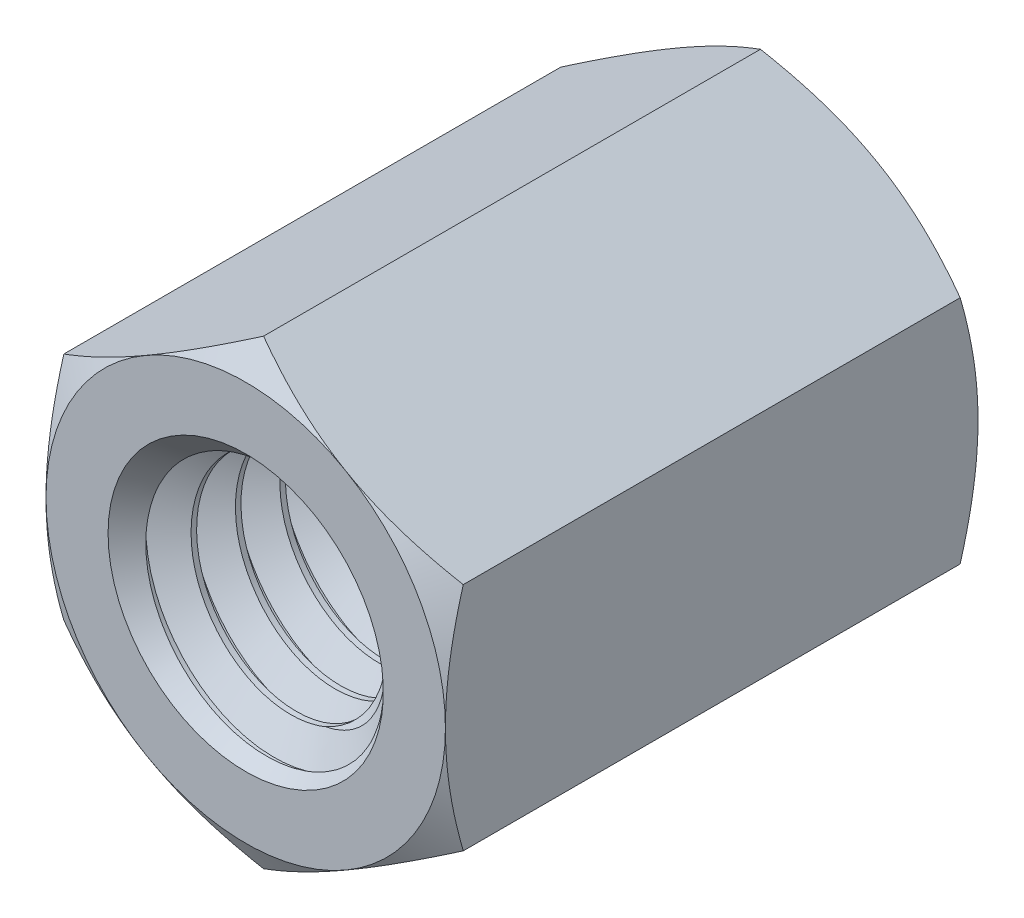
from build123d import *

# Parameters (mm, degrees)
EXTRUDE1_DEPTH          = 3
EXTRUDE1_DEPTH_BACK     = 3
SKETCH1_R               = 1.5
SWEEP1_PITCH            = 0.5
EXTRUDE2_DEPTH          = 8.352873858
SKETCH8_OUTSIDE_W       = 37.328
SKETCH8_OUTSIDE_H       = 38.024
SKETCH8_OUTSIDE_R       = 2.25
EXTRUDE4_DEPTH          = 8.352873858
EXTRUDE4_DRAFT          = -60
MIRROR1_COPY_1_SKETCH_W = 37.328
MIRROR1_COPY_1_SKETCH_H = 38.024
MIRROR1_COPY_1_SKETCH_R = 2.25
MIRROR1_COPY_1_DEPTH    = 8.352873858
MIRROR1_COPY_1_DRAFT    = -60


with BuildPart() as part:
    # Sketch1 → Extrude1 (new, two sides: drawn at the far end of the back side and taken through both)
    with BuildSketch(Plane.XY.offset(-EXTRUDE1_DEPTH_BACK)):
        Polygon((0, 2.598076211), (-2.25, 1.299038106), (-2.25, -1.299038106), (0, -2.598076211), (2.25, -1.299038106), (2.25, 1.299038106), align=None)
        Circle(SKETCH1_R, mode=Mode.SUBTRACT)
    extrude(amount=EXTRUDE1_DEPTH + EXTRUDE1_DEPTH_BACK)

    # Sweep1: the profile of Sketch12 profile screwed along a right-hand helix of 13 turns, 6 arcs to a turn; built about Z, then put on its axis
    sweep1_z = Axis((0, 0, 0), (0, 0, 1))
    sweep1_corners = [(1.5003, 0, -0.437673205), (1.5003, 0, 0.000173205), (1.175240474, 0, -0.1875), (1.175240474, 0, -0.25)]
    with BuildLine(mode=Mode.PRIVATE) as sweep1_profile:
        Line(sweep1_corners[0], sweep1_corners[1])
        Line(sweep1_corners[1], sweep1_corners[2])
        Line(sweep1_corners[2], sweep1_corners[3])
        Line(sweep1_corners[3], sweep1_corners[0])
    sweep1_cap = Face(sweep1_profile.wire())
    sweep1_turn_angles = [0, 30, 60, 90, 120, 150, 180, 210, 240, 270, 300, 330, 360]
    sweep1_turn_weights = [1, 0.8660254037844387, 1, 0.8660254037844387, 1, 0.8660254037844387, 1, 0.8660254037844387, 1, 0.8660254037844387, 1, 0.8660254037844387, 1]
    sweep1_turn_rails = [Edge.make_bspline([Vector(p[0], p[1], 0).rotate(sweep1_z, sweep1_turn_angles[k]) / sweep1_turn_weights[k] + Vector(0, 0, p[2] + SWEEP1_PITCH * sweep1_turn_angles[k] / 360) for k in range(13)], [0, 0, 0, 1, 1, 2, 2, 3, 3, 4, 4, 5, 5, 6, 6, 6], 2, sweep1_turn_weights) for p in sweep1_corners]
    sweep1_turn_sides = [Face.make_surface_from_curves(sweep1_turn_rails[p[0]], sweep1_turn_rails[p[1]]) for p in [(0, 1), (1, 2), (2, 3), (3, 0)]]
    sweep1 = Plane(origin=(0, 0, -3), x_dir=(0, 1, 0), z_dir=(0, 0, 1)) * Solid(Shell([*[p.moved(Location((0, 0, SWEEP1_PITCH * i))) for i in range(13) for p in sweep1_turn_sides], sweep1_cap, sweep1_cap.rotate(sweep1_z, 4680).moved(Location((0, 0, SWEEP1_PITCH * 4680 / 360)))]))
    add(sweep1)

    # Sketch6 → Extrude2 (cut, through all)
    with BuildSketch(Plane(origin=(0, 0, -3), x_dir=(-1, 0, 0), z_dir=(0, 0, -1))):
        Polygon((0, 2.598076211), (-2.25, 1.299038106), (-2.25, -1.299038106), (0, -2.598076211), (2.25, -1.299038106), (2.25, 1.299038106), align=None)
    extrude2 = extrude(amount=EXTRUDE2_DEPTH, mode=Mode.SUBTRACT)

    # Extrude3 cone 1 section (through the dimple's axis) → Extrude3 (revolve, cut)
    with BuildSketch(Plane(origin=(0, 0, -3), x_dir=(0, 1, 0), z_dir=(1, 0, 0))):
        Polygon((0, 0), (1.5508, 0), (0, 1.663029396), align=None)
    extrude3 = revolve(axis=Axis((0, 0, -3), (0, 0, 1)), mode=Mode.SUBTRACT)


with BuildPart() as extrude4_tool:
    # Sketch8 outside → Extrude4 (with draft: the straight prism first)
    with BuildSketch(Plane(origin=(0, 0, -3), x_dir=(-1, 0, 0), z_dir=(0, 0, -1))):
        Rectangle(SKETCH8_OUTSIDE_W, SKETCH8_OUTSIDE_H)
        Circle(SKETCH8_OUTSIDE_R, mode=Mode.SUBTRACT)
    extrude(amount=-EXTRUDE4_DEPTH)
    # Extrude4: the draft: its side faces are tilted about the plane it starts from
    extrude4_sides = [extrude4_tool.faces().sort_by_distance(p)[0] for p in [
        (0, -19.012, 1.176436929),
        (-18.664, 0, 1.176436929),
        (0, 19.012, 1.176436929),
        (18.664, 0, 1.176436929),
        (2.25, 0, 1.176436929),
    ]]
    draft(extrude4_sides, Plane(origin=(0, 0, -3), x_dir=(-1, 0, 0), z_dir=(0, 0, -1)), EXTRUDE4_DRAFT)


with BuildPart() as part_1:
    add(part.part)

    # Extrude4: cut by extrude4_tool
    add(extrude4_tool.part, mode=Mode.SUBTRACT)

    # Mirror1: Extrude2, Extrude3 across plane
    add(extrude2.mirror(Plane.XY), mode=Mode.SUBTRACT)
    add(extrude3.mirror(Plane.XY), mode=Mode.SUBTRACT)


with BuildPart() as mirror1_copy_1_tool:
    # Mirror1 copy 1 sketch → Mirror1 copy 1 (with draft: the straight prism first)
    with BuildSketch(Plane(origin=(0, 0, 3), x_dir=(-1, 0, 0), z_dir=(0, 0, 1))):
        Rectangle(MIRROR1_COPY_1_SKETCH_W, MIRROR1_COPY_1_SKETCH_H)
        Circle(MIRROR1_COPY_1_SKETCH_R, mode=Mode.SUBTRACT)
    extrude(amount=-MIRROR1_COPY_1_DEPTH)
    # Mirror1 copy 1: the draft: its side faces are tilted about the plane it starts from
    mirror1_copy_1_sides = [mirror1_copy_1_tool.faces().sort_by_distance(p)[0] for p in [
        (0, -19.012, -1.176436929),
        (-18.664, 0, -1.176436929),
        (0, 19.012, -1.176436929),
        (18.664, 0, -1.176436929),
        (2.25, 0, -1.176436929),
    ]]
    draft(mirror1_copy_1_sides, Plane(origin=(0, 0, 3), x_dir=(-1, 0, 0), z_dir=(0, 0, 1)), MIRROR1_COPY_1_DRAFT)


with BuildPart() as part_2:
    add(part_1.part)

    # Mirror1 copy 1: cut by mirror1_copy_1_tool
    add(mirror1_copy_1_tool.part, mode=Mode.SUBTRACT)


solid = part_2.part
